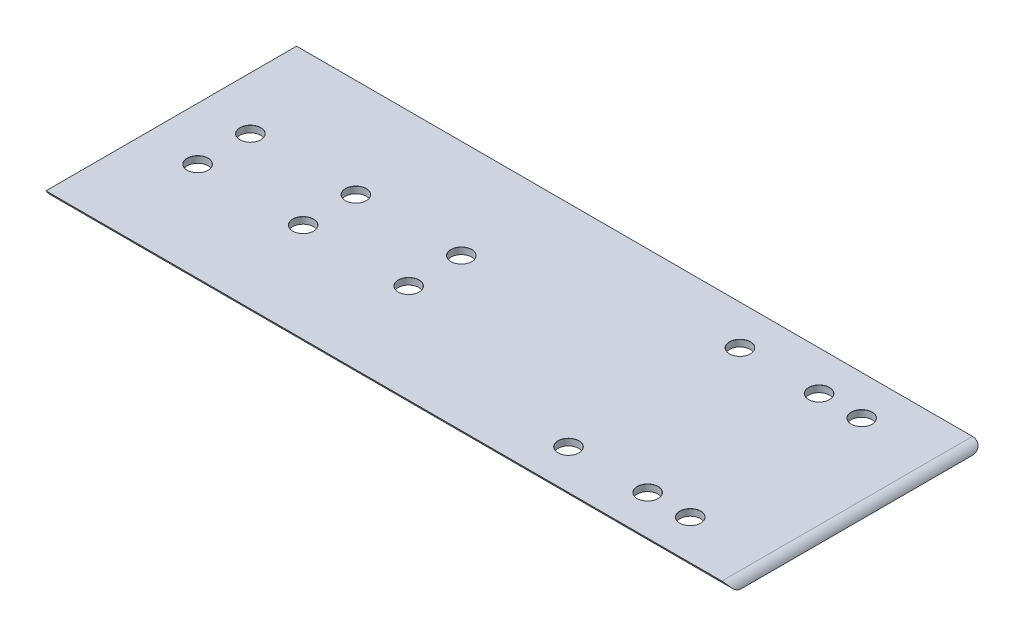
from build123d import *

# Parameters (mm, degrees)
BOSS_EXTRUDE1_START            = -131.7625
BOSS_EXTRUDE1_DEPTH            = 60.325
F_5_0MM_DOWEL_HOLE1_AT_2_COUNT = 2
F_5_0MM_DOWEL_HOLE1_AT_2_PITCH = 12.7
F_5_0MM_DOWEL_HOLE1_AT_3_COUNT = 2
F_5_0MM_DOWEL_HOLE1_AT_3_PITCH = 28.398063314
F_5_0MM_DOWEL_HOLE1_AT_4_COUNT = 2
F_5_0MM_DOWEL_HOLE1_AT_4_PITCH = 25.4
F_5_0MM_DOWEL_HOLE1_AT_5_COUNT = 2
F_5_0MM_DOWEL_HOLE1_AT_5_PITCH = 50.8
F_5_0MM_DOWEL_HOLE1_AT_6_COUNT = 2
F_5_0MM_DOWEL_HOLE1_AT_6_PITCH = 52.363441445
FILLET2_R                      = 2.54
FILLET3_R                      = 2.54
FILLET4_R                      = 2.54
F_5_0MM_DOWEL_HOLE2_AT_2_COUNT = 2
F_5_0MM_DOWEL_HOLE2_AT_2_PITCH = 41.275
F_5_0MM_DOWEL_HOLE2_AT_3_COUNT = 2
F_5_0MM_DOWEL_HOLE2_AT_3_PITCH = 45.459081876
F_5_0MM_DOWEL_HOLE2_AT_4_COUNT = 2
F_5_0MM_DOWEL_HOLE2_AT_4_PITCH = 50.624060678
F_5_0MM_DOWEL_HOLE2_AT_5_COUNT = 2
F_5_0MM_DOWEL_HOLE2_AT_5_PITCH = 29.3116
F_5_0MM_DOWEL_HOLE2_AT_6_COUNT = 2
F_5_0MM_DOWEL_HOLE2_AT_6_PITCH = 19.05


with BuildPart() as part:
    # Sketch5 → Boss-Extrude1 (new body)
    with BuildSketch(Plane.XY.offset(BOSS_EXTRUDE1_START)):
        Polygon((50.8, 99.695), (50.8, 98.1075), (138.43, 98.1075), (215.9, 98.1075), (215.9, 99.695), align=None)
    extrude(amount=BOSS_EXTRUDE1_DEPTH)

    # Sketch7 → Ø5.0mm Dowel Hole1 (revolve, cut)
    with BuildSketch(Plane(origin=(114.3, 99.695, -107.95), x_dir=(0, 0, 1), z_dir=(1, 0, 0))):
        Polygon((0, 0), (0, 1.5875), (2.5, 1.5875), (2.5, 0.025), (2.525, 0), align=None)
    f_5_0mm_dowel_hole1 = revolve(axis=Axis((114.3, 106.045, -107.95), (0, -1, 0)), mode=Mode.SUBTRACT)

    # Ø5.0mm Dowel Hole1 at 2: Ø5.0mm Dowel Hole1 ×2
    with Locations(*[(0, 0, i * F_5_0MM_DOWEL_HOLE1_AT_2_PITCH) for i in range(1, F_5_0MM_DOWEL_HOLE1_AT_2_COUNT)]):
        add(f_5_0mm_dowel_hole1, mode=Mode.SUBTRACT)

    # Ø5.0mm Dowel Hole1 at 3: Ø5.0mm Dowel Hole1 ×2
    with Locations(*[Vector(-0.894427190999915, 0, 0.44721359549996) * (i * F_5_0MM_DOWEL_HOLE1_AT_3_PITCH) for i in range(1, F_5_0MM_DOWEL_HOLE1_AT_3_COUNT)]):
        add(f_5_0mm_dowel_hole1, mode=Mode.SUBTRACT)

    # Ø5.0mm Dowel Hole1 at 4: Ø5.0mm Dowel Hole1 ×2
    with Locations(*[(-i * F_5_0MM_DOWEL_HOLE1_AT_4_PITCH, 0, 0) for i in range(1, F_5_0MM_DOWEL_HOLE1_AT_4_COUNT)]):
        add(f_5_0mm_dowel_hole1, mode=Mode.SUBTRACT)

    # Ø5.0mm Dowel Hole1 at 5: Ø5.0mm Dowel Hole1 ×2
    with Locations(*[(-i * F_5_0MM_DOWEL_HOLE1_AT_5_PITCH, 0, 0) for i in range(1, F_5_0MM_DOWEL_HOLE1_AT_5_COUNT)]):
        add(f_5_0mm_dowel_hole1, mode=Mode.SUBTRACT)

    # Ø5.0mm Dowel Hole1 at 6: Ø5.0mm Dowel Hole1 ×2
    with Locations(*[Vector(-0.9701425001453318, 0, 0.2425356250363337) * (i * F_5_0MM_DOWEL_HOLE1_AT_6_PITCH) for i in range(1, F_5_0MM_DOWEL_HOLE1_AT_6_COUNT)]):
        add(f_5_0mm_dowel_hole1, mode=Mode.SUBTRACT)

    # Fillet2
    # the kernel refuses this fillet: 2.54 mm, written as the material it takes off along each edge
    with BuildSketch(Plane(origin=(215.9, 99.695, -137.649107549), x_dir=(-1, 0, 0), z_dir=(0, 0, 1))) as fillet2_piece_1:
        with BuildLine():
            CenterArc((2.35464302, 2.54), FILLET2_R, 202.024312837, 67.975687163)
            Line((0, 1.5875), (-0.04709286, 1.56845))
            ThreePointArc((-0.04709286, 1.56845), (-0.0508, 0.79375), (-0.0508, 0))
            Line((-0.0508, 0), (0, -0.0508))
            Line((0, -0.0508), (2.35464302, -0.0508))
            Line((2.35464302, -0.0508), (2.35464302, 0))
        make_face()
    extrude(amount=72.098215098, mode=Mode.SUBTRACT)

    # Fillet3
    # the kernel refuses this fillet: 2.54 mm, written as the material it takes off along each edge
    with BuildSketch(Plane(origin=(221.786607549, 98.1075, -71.4375), x_dir=(0, 0, -1), z_dir=(-1, 0, 0))) as fillet3_piece_1:
        with BuildLine():
            CenterArc((2.35464302, -2.54), FILLET3_R, 90, 67.975687163)
            Line((0, -1.5875), (-0.04709286, -1.56845))
            ThreePointArc((-0.04709286, -1.56845), (-0.0508, -0.79375), (-0.0508, 0))
            Line((-0.0508, 0), (0, 0.0508))
            Line((0, 0.0508), (2.35464302, 0.0508))
            Line((2.35464302, 0.0508), (2.35464302, 0))
        make_face()
    extrude(amount=176.873215098, mode=Mode.SUBTRACT)

    # Fillet4
    # the kernel refuses this fillet: 2.54 mm, written as the material it takes off along each edge
    with BuildSketch(Plane(origin=(44.913392451, 98.1075, -131.7625), x_dir=(0, 1, 0), z_dir=(1, 0, 0))) as fillet4_piece_1:
        with BuildLine():
            CenterArc((2.54, 2.35464302), FILLET4_R, 180, 67.975687163)
            Line((0, 2.35464302), (-0.0508, 2.35464302))
            Line((-0.0508, 2.35464302), (-0.0508, 0))
            Line((-0.0508, 0), (0, -0.0508))
            ThreePointArc((0, -0.0508), (0.79375, -0.0508), (1.56845, -0.04709286))
            Line((1.56845, -0.04709286), (1.5875, 0))
        make_face()
    extrude(amount=176.873215098, mode=Mode.SUBTRACT)
    with BuildSketch(Plane(origin=(50.8, 98.1075, -137.649107549), x_dir=(0, 1, 0), z_dir=(0, 0, 1))) as fillet4_piece_2:
        with BuildLine():
            CenterArc((2.54, -2.35464302), FILLET4_R, 112.024312837, 67.975687163)
            Line((0, -2.35464302), (-0.0508, -2.35464302))
            Line((-0.0508, -2.35464302), (-0.0508, 0))
            Line((-0.0508, 0), (0, 0.0508))
            ThreePointArc((0, 0.0508), (0.79375, 0.0508), (1.56845, 0.04709286))
            Line((1.56845, 0.04709286), (1.5875, 0))
        make_face()
    extrude(amount=69.743572079, mode=Mode.SUBTRACT)

    # Sketch9 → Ø5.0mm Dowel Hole2 (revolve, cut)
    with BuildSketch(Plane(origin=(167.083317581, 99.695, -122.2375), x_dir=(0, 0, 1), z_dir=(1, 0, 0))):
        Polygon((0, 0), (0, 1.5875), (2.5, 1.5875), (2.5, 0.025), (2.525, 0), align=None)
    f_5_0mm_dowel_hole2 = revolve(axis=Axis((167.083317581, 106.045, -122.2375), (0, -1, 0)), mode=Mode.SUBTRACT)

    # Ø5.0mm Dowel Hole2 at 2: Ø5.0mm Dowel Hole2 ×2
    with Locations(*[(0, 0, i * F_5_0MM_DOWEL_HOLE2_AT_2_PITCH) for i in range(1, F_5_0MM_DOWEL_HOLE2_AT_2_COUNT)]):
        add(f_5_0mm_dowel_hole2, mode=Mode.SUBTRACT)

    # Ø5.0mm Dowel Hole2 at 3: Ø5.0mm Dowel Hole2 ×2
    with Locations(*[Vector(0.41905817746174606, 0, 0.9079593845004521) * (i * F_5_0MM_DOWEL_HOLE2_AT_3_PITCH) for i in range(1, F_5_0MM_DOWEL_HOLE2_AT_3_COUNT)]):
        add(f_5_0mm_dowel_hole2, mode=Mode.SUBTRACT)

    # Ø5.0mm Dowel Hole2 at 4: Ø5.0mm Dowel Hole2 ×2
    with Locations(*[Vector(0.5790053110568745, 0, 0.8153237699024432) * (i * F_5_0MM_DOWEL_HOLE2_AT_4_PITCH) for i in range(1, F_5_0MM_DOWEL_HOLE2_AT_4_COUNT)]):
        add(f_5_0mm_dowel_hole2, mode=Mode.SUBTRACT)

    # Ø5.0mm Dowel Hole2 at 5: Ø5.0mm Dowel Hole2 ×2
    with Locations(*[(i * F_5_0MM_DOWEL_HOLE2_AT_5_PITCH, 0, 0) for i in range(1, F_5_0MM_DOWEL_HOLE2_AT_5_COUNT)]):
        add(f_5_0mm_dowel_hole2, mode=Mode.SUBTRACT)

    # Ø5.0mm Dowel Hole2 at 6: Ø5.0mm Dowel Hole2 ×2
    with Locations(*[(i * F_5_0MM_DOWEL_HOLE2_AT_6_PITCH, 0, 0) for i in range(1, F_5_0MM_DOWEL_HOLE2_AT_6_COUNT)]):
        add(f_5_0mm_dowel_hole2, mode=Mode.SUBTRACT)


solid = part.part
